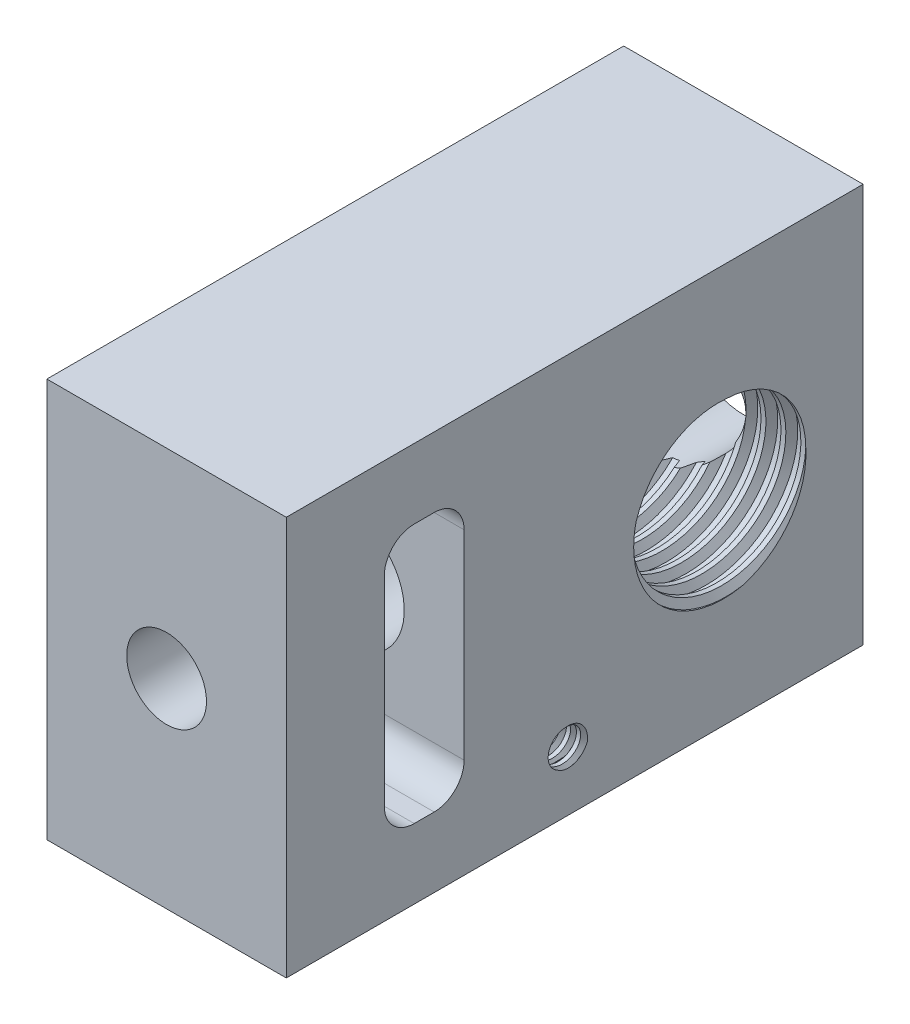
from build123d import *

# Parameters (mm, degrees)
SKETCH1_W               = 45.8978
SKETCH1_H               = 31.75
SKETCH1_R               = 6.5484375
BOSS_EXTRUDE1_DEPTH     = 9.525
SKETCH2_R               = 3.175
CUT_EXTRUDE1_DEPTH      = 25.4
SKETCH3_R               = 4.7625
CUT_EXTRUDE2_DEPTH      = 38.1
CUT_SWEEP1_PITCH        = 1.5875
CUT_EXTRUDE3_DEPTH      = 30.485475592
CUT_EXTRUDE3_DEPTH_BACK = 30.485475592
SKETCH6_R               = 1.3890625
CUT_SWEEP2_PITCH        = 0.79375


with BuildPart() as part:
    # Sketch1 → Boss-Extrude1 (new, symmetric)
    with BuildSketch(Plane(origin=(0, 0, 0), x_dir=(0, 0, -1), z_dir=(1, 0, 0))):
        Rectangle(SKETCH1_W, SKETCH1_H)
        with Locations(Location((11.8364, 0, 0), (0, 0, 180))):
            Circle(SKETCH1_R, mode=Mode.SUBTRACT)
    extrude(amount=BOSS_EXTRUDE1_DEPTH, both=True)

    # Sketch2 → Cut-Extrude1 (cut)
    with BuildSketch(Plane.XY.offset(22.9489)):
        Circle(SKETCH2_R)
    extrude(amount=-CUT_EXTRUDE1_DEPTH, mode=Mode.SUBTRACT)

    # Sketch3 → Cut-Extrude2 (cut)
    with BuildSketch(Plane(origin=(0, 0, -22.9489), x_dir=(-1, 0, 0), z_dir=(0, 0, -1))):
        Circle(SKETCH3_R)
    extrude(amount=-CUT_EXTRUDE2_DEPTH, mode=Mode.SUBTRACT)

    # Cut-Sweep1: the profile of Sketch4 profile screwed along a right-hand helix of 16 turns, 8 arcs to a turn; built about Z, then put on its axis
    cut_sweep1_z = Axis((0, 0, 0), (0, 0, 1))
    cut_sweep1_corners = [(6.5481375, 0, 0.000173205), (7.14375, 0, -0.343703832), (7.14375, 0, -0.851703832), (6.5481375, 0, -1.195580869)]
    with BuildLine(mode=Mode.PRIVATE) as cut_sweep1_profile:
        Line(cut_sweep1_corners[0], cut_sweep1_corners[1])
        Line(cut_sweep1_corners[1], cut_sweep1_corners[2])
        Line(cut_sweep1_corners[2], cut_sweep1_corners[3])
        Line(cut_sweep1_corners[3], cut_sweep1_corners[0])
    cut_sweep1_cap = Face(cut_sweep1_profile.wire())
    cut_sweep1_turn_angles = [0, 22.5, 45, 67.5, 90, 112.5, 135, 157.5, 180, 202.5, 225, 247.5, 270, 292.5, 315, 337.5, 360]
    cut_sweep1_turn_weights = [1, 0.9238795325112867, 1, 0.9238795325112867, 1, 0.9238795325112867, 1, 0.9238795325112867, 1, 0.9238795325112867, 1, 0.9238795325112867, 1, 0.9238795325112867, 1, 0.9238795325112867, 1]
    cut_sweep1_turn_rails = [Edge.make_bspline([Vector(p[0], p[1], 0).rotate(cut_sweep1_z, cut_sweep1_turn_angles[k]) / cut_sweep1_turn_weights[k] + Vector(0, 0, p[2] + CUT_SWEEP1_PITCH * cut_sweep1_turn_angles[k] / 360) for k in range(17)], [0, 0, 0, 1, 1, 2, 2, 3, 3, 4, 4, 5, 5, 6, 6, 7, 7, 8, 8, 8], 2, cut_sweep1_turn_weights) for p in cut_sweep1_corners]
    cut_sweep1_turn_sides = [Face.make_surface_from_curves(cut_sweep1_turn_rails[p[0]], cut_sweep1_turn_rails[p[1]]) for p in [(0, 1), (1, 2), (2, 3), (3, 0)]]
    cut_sweep1 = Plane(origin=(9.525, 0, -11.8364), x_dir=(0, 0, -1), z_dir=(-1, 0, 0)) * Solid(Shell([*[p.moved(Location((0, 0, CUT_SWEEP1_PITCH * i))) for i in range(16) for p in cut_sweep1_turn_sides], cut_sweep1_cap, cut_sweep1_cap.rotate(cut_sweep1_z, 5760).moved(Location((0, 0, CUT_SWEEP1_PITCH * 5760 / 360)))]))
    add(cut_sweep1, mode=Mode.SUBTRACT)

    # Sketch6 → Cut-Extrude3 (cut, two sides: drawn at the far end of the back side and taken through both)
    with BuildSketch(Plane(origin=(0, 0, 0), x_dir=(0, 0, -1), z_dir=(1, 0, 0)).offset(-CUT_EXTRUDE3_DEPTH_BACK)):
        with Locations(Location((-0.7239, -11.1125, 0), (0, 0, 180))):
            Circle(SKETCH6_R)
        with BuildLine():
            Line((-12.76985, 10.31875), (-11.18235, 10.31875))
            ThreePointArc((-11.18235, 10.31875), (-9.498551977, 9.621298023), (-8.8011, 7.9375))
            Line((-8.8011, 7.9375), (-8.8011, -7.9375))
            ThreePointArc((-8.8011, -7.9375), (-9.498551977, -9.621298023), (-11.18235, -10.31875))
            Line((-11.18235, -10.31875), (-12.76985, -10.31875))
            ThreePointArc((-12.76985, -10.31875), (-14.453648023, -9.621298023), (-15.1511, -7.9375))
            Line((-15.1511, -7.9375), (-15.1511, 7.9375))
            ThreePointArc((-15.1511, 7.9375), (-14.453648023, 9.621298023), (-12.76985, 10.31875))
        make_face()
    extrude(amount=CUT_EXTRUDE3_DEPTH + CUT_EXTRUDE3_DEPTH_BACK, mode=Mode.SUBTRACT)

    # Cut-Sweep2: the profile of Sketch7 profile screwed along a right-hand helix of 32 turns, 8 arcs to a turn; built about Z, then put on its axis
    cut_sweep2_z = Axis((0, 0, 0), (0, 0, 1))
    cut_sweep2_corners = [(0.982003381, 0.982003381, 0.000173205), (1.262848517, 1.262848517, -0.229135888), (0.982003381, 0.982003381, -0.458444981)]
    with BuildLine(mode=Mode.PRIVATE) as cut_sweep2_profile:
        Line(cut_sweep2_corners[0], cut_sweep2_corners[1])
        Line(cut_sweep2_corners[1], cut_sweep2_corners[2])
        Line(cut_sweep2_corners[2], cut_sweep2_corners[0])
    cut_sweep2_cap = Face(cut_sweep2_profile.wire())
    cut_sweep2_turn_angles = [0, 22.5, 45, 67.5, 90, 112.5, 135, 157.5, 180, 202.5, 225, 247.5, 270, 292.5, 315, 337.5, 360]
    cut_sweep2_turn_weights = [1, 0.9238795325112867, 1, 0.9238795325112867, 1, 0.9238795325112867, 1, 0.9238795325112867, 1, 0.9238795325112867, 1, 0.9238795325112867, 1, 0.9238795325112867, 1, 0.9238795325112867, 1]
    cut_sweep2_turn_rails = [Edge.make_bspline([Vector(p[0], p[1], 0).rotate(cut_sweep2_z, cut_sweep2_turn_angles[k]) / cut_sweep2_turn_weights[k] + Vector(0, 0, p[2] + CUT_SWEEP2_PITCH * cut_sweep2_turn_angles[k] / 360) for k in range(17)], [0, 0, 0, 1, 1, 2, 2, 3, 3, 4, 4, 5, 5, 6, 6, 7, 7, 8, 8, 8], 2, cut_sweep2_turn_weights) for p in cut_sweep2_corners]
    cut_sweep2_turn_sides = [Face.make_surface_from_curves(cut_sweep2_turn_rails[p[0]], cut_sweep2_turn_rails[p[1]]) for p in [(0, 1), (1, 2), (2, 0)]]
    cut_sweep2 = Plane(origin=(9.525, -11.1125, 0.7239), x_dir=(0, 0.7071067811865435, 0.7071067811865516), z_dir=(-1, 0, 0)) * Solid(Shell([*[p.moved(Location((0, 0, CUT_SWEEP2_PITCH * i))) for i in range(32) for p in cut_sweep2_turn_sides], cut_sweep2_cap, cut_sweep2_cap.rotate(cut_sweep2_z, 11520).moved(Location((0, 0, CUT_SWEEP2_PITCH * 11520 / 360)))]))
    add(cut_sweep2, mode=Mode.SUBTRACT)


solid = part.part
